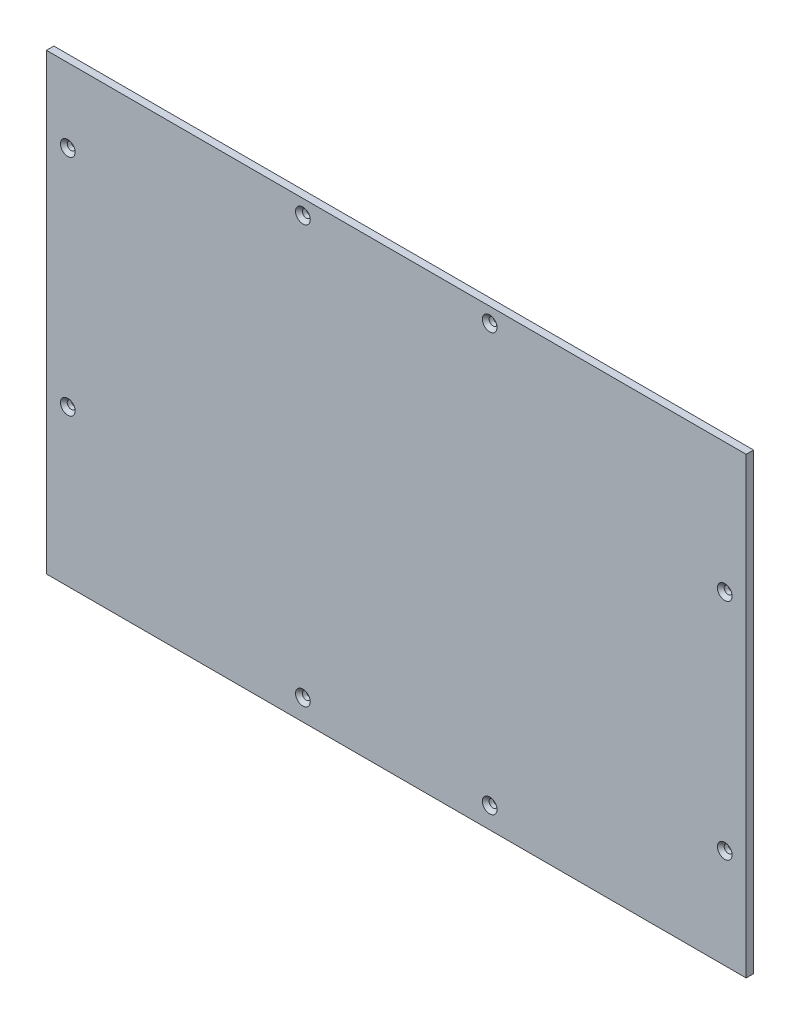
from build123d import *

# Parameters (mm, degrees)
SKETCH1_W                                       = 299.7
SKETCH1_H                                       = 194.25
BOSS_EXTRUDE1_DEPTH                             = 3.175
CSK_FOR_M3_FLAT_HEAD_MACHINE_SCREW1_D           = 3.4
CSK_FOR_M3_FLAT_HEAD_MACHINE_SCREW1_CSINK_D     = 6.3
CSK_FOR_M3_FLAT_HEAD_MACHINE_SCREW1_CSINK_ANGLE = 90


with BuildPart() as part:
    # Sketch1 → Boss-Extrude1 (new body)
    with BuildSketch(Plane.XY):
        Rectangle(SKETCH1_W, SKETCH1_H)
    extrude(amount=BOSS_EXTRUDE1_DEPTH)

    # CSK for M3 Flat Head Machine Screw1 (through all)
    with Locations(Plane.XY.offset(3.175)):
        with Locations((-40, 90.775000052), (140.687500033, 41.475000052), (140.687500033, -54.524999948), (40, -88.030749948), (-40, -88.030749948), (-140.687500033, -30.524999948), (-140.687500033, 65.475000052), (40, 90.775000052)):
            CounterSinkHole(CSK_FOR_M3_FLAT_HEAD_MACHINE_SCREW1_D / 2, CSK_FOR_M3_FLAT_HEAD_MACHINE_SCREW1_CSINK_D / 2, counter_sink_angle=CSK_FOR_M3_FLAT_HEAD_MACHINE_SCREW1_CSINK_ANGLE)


solid = part.part
